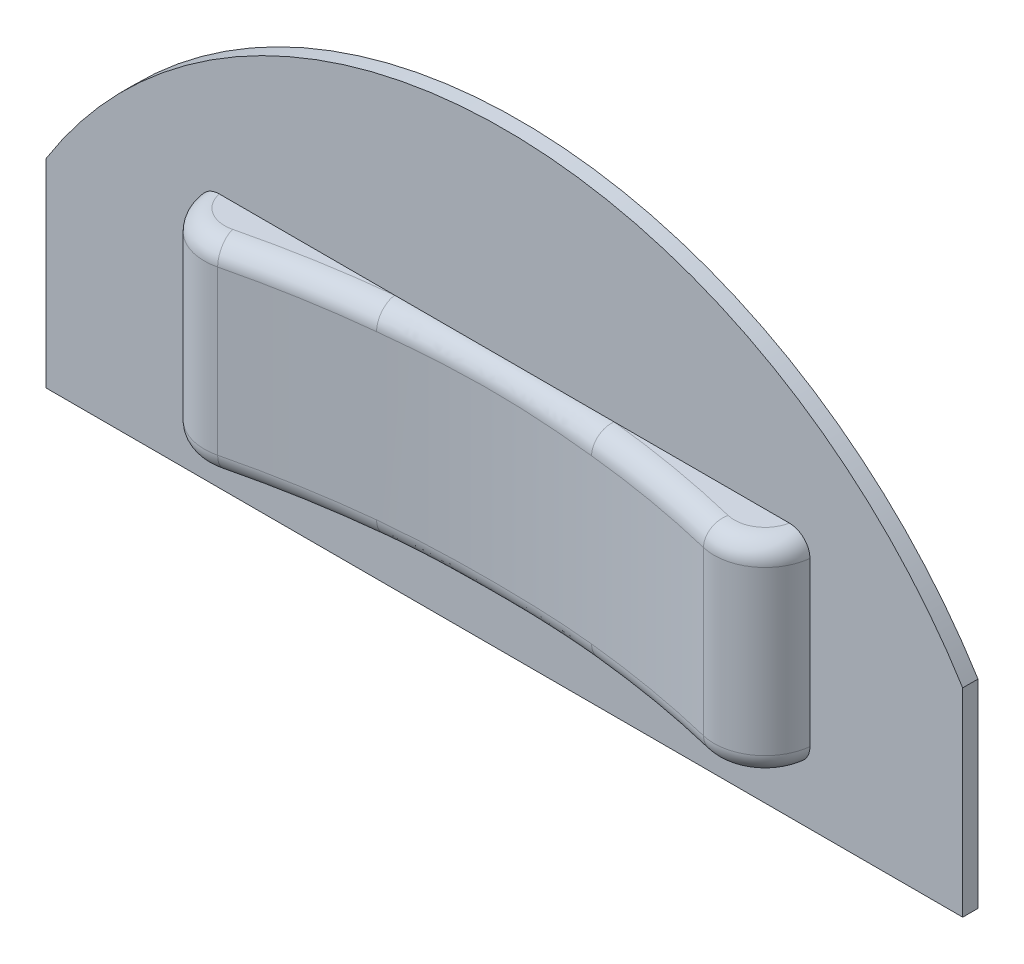
from build123d import *

# Parameters (mm, degrees)
BOSS_EXTRUDE1_DEPTH = 3
SKETCH2_W           = 120
SKETCH2_H           = 40
BOSS_EXTRUDE2_DEPTH = 12
CUT_EXTRUDE1_REACH  = 189.417
FILLET1_R           = 10
FILLET2_R           = 4


with BuildPart() as part:
    # Sketch1 → Boss-Extrude1 (new body)
    with BuildSketch(Plane.XY):
        with BuildLine():
            Line((180, 0), (180, -39))
            Line((180, -39), (0, -39))
            Line((0, -39), (0, 0))
            ThreePointArc((0, 0), (90, 50), (180, 0))
        make_face()
    extrude(amount=BOSS_EXTRUDE1_DEPTH)

    # Sketch2 → Boss-Extrude2 (add)
    with BuildSketch(Plane.XY.offset(3)):
        with Locations((90, -9)):
            Rectangle(SKETCH2_W, SKETCH2_H)
    extrude(amount=BOSS_EXTRUDE2_DEPTH)

    # Sketch3 → Cut-Extrude1 (cut, up to next)
    with BuildSketch(Plane(origin=(0, 11, 0), x_dir=(1, 0, 0), z_dir=(0, 1, 0)), mode=Mode.PRIVATE) as cut_extrude1_sk1:
        with BuildLine():
            Line((30, -15), (150, -15))
            ThreePointArc((150, -15), (90, -5.870751133), (30, -15))
        make_face()
    cut_extrude1_tool1 = extrude(cut_extrude1_sk1.sketch, amount=-CUT_EXTRUDE1_REACH, mode=Mode.PRIVATE) & part.part
    add(cut_extrude1_tool1.solids().sort_by_distance((90, 11, 11.341124))[0], mode=Mode.SUBTRACT)

    # Fillet1
    # the kernel refuses this fillet: 10 mm, written as the material it takes off along each edge
    with BuildSketch(Plane(origin=(150, 42.911423728, 15), x_dir=(0, 0, -1), z_dir=(0, -1, 0)), Plane(origin=(30, -60.911423728, 15), x_dir=(0, 0, -1), z_dir=(0, 1, 0))) as fillet1_piece_1:
        with BuildLine():
            CenterArc((13.125456564, -9.936465545), FILLET1_R, 96.462082414, 97.214818073)
            Line((3.409011311, -12.300929891), (3.214682406, -12.348219178))
            ThreePointArc((3.214682406, -12.348219178), (1.609086457, -6.176908891), (-0.190949181, -0.059484539))
            Line((-0.190949181, -0.059484539), (0, 0.2))
            ThreePointArc((0, 0.2), (6, 0.2), (11.977490869, 0.198729311))
            Line((11.977490869, 0.198729311), (12, 0))
        make_face()
    extrude(amount=103.822847456, mode=Mode.SUBTRACT)

    # Fillet2
    fillet2_edges = [part.edges().sort_by_distance(p)[0] for p in [
        (90, -29, 5.870751133),
        (90, 11, 5.870751133),
        (34.210640521, 11, 10.073014501),
        (145.789359479, 11, 10.073014501),
        (34.210640521, -29, 10.073014501),
        (145.789359479, -29, 10.073014501),
    ]]
    fillet(fillet2_edges, radius=FILLET2_R)


solid = part.part
